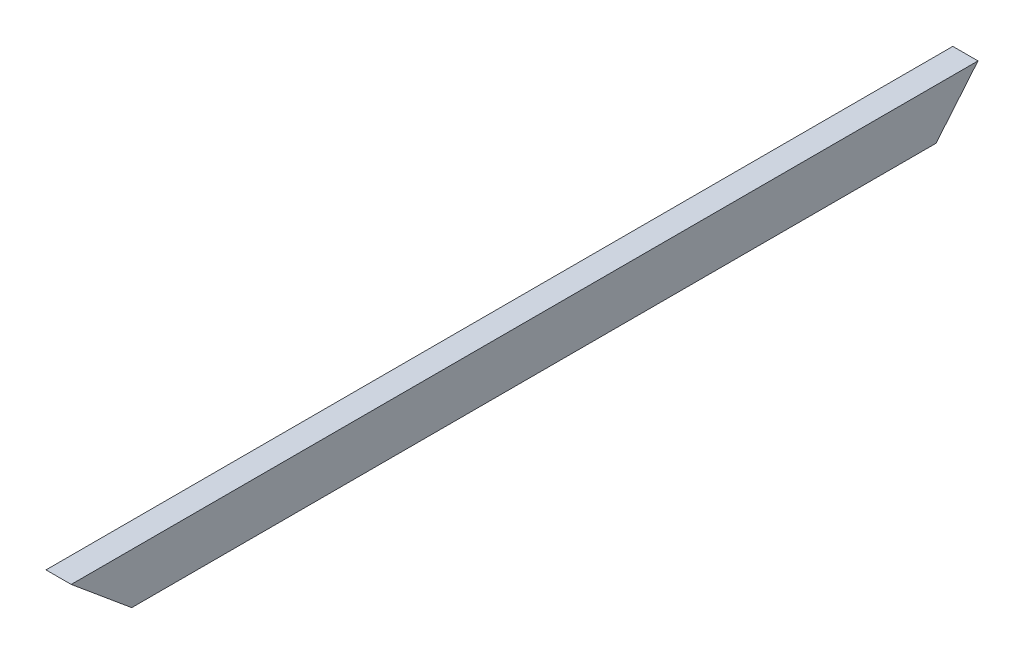
from build123d import *

# Parameters (mm, degrees)
SKETCH1_W           = 12.7
SKETCH1_H           = 25.4
SKETCH1_W_2         = 6.35
SKETCH1_H_2         = 19.05
BOSS_EXTRUDE1_DEPTH = 457.2
CUT_EXTRUDE1_DEPTH  = 459.081095441
CUT_EXTRUDE2_DEPTH  = 459.081095441


with BuildPart() as part:
    # Sketch1 → Boss-Extrude1 (new body)
    with BuildSketch(Plane.XY):
        with Locations((6.35, 12.7)):
            Rectangle(SKETCH1_W, SKETCH1_H)
        with Locations((6.35, 12.7)):
            Rectangle(SKETCH1_W_2, SKETCH1_H_2, mode=Mode.SUBTRACT)
    extrude(amount=BOSS_EXTRUDE1_DEPTH)

    # Sketch2 → Cut-Extrude1 (cut, through all)
    with BuildSketch(Plane(origin=(12.7, 0, 0), x_dir=(0, 0, -1), z_dir=(1, 0, 0))):
        Polygon((-457.2, 25.4), (-426.675136186, 0), (-457.2, 0), align=None)
    extrude(amount=-CUT_EXTRUDE1_DEPTH, mode=Mode.SUBTRACT)

    # Sketch3 → Cut-Extrude2 (cut, through all)
    with BuildSketch(Plane(origin=(12.7, 0, 0), x_dir=(0, 0, -1), z_dir=(1, 0, 0))):
        Polygon((-21.13555703, 0), (0, 25.4), (0, 0), align=None)
    extrude(amount=-CUT_EXTRUDE2_DEPTH, mode=Mode.SUBTRACT)


solid = part.part
